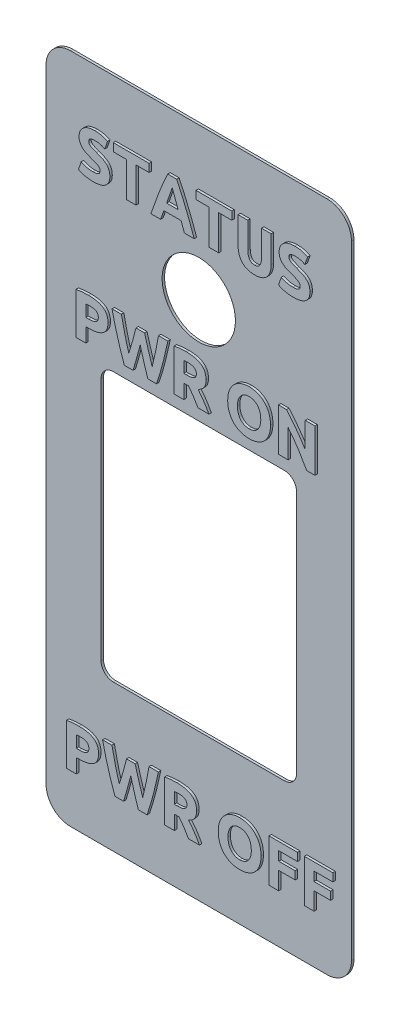
from build123d import *

# Parameters (mm, degrees)
SKETCH1_W       = 25
SKETCH1_H       = 55
BODY_DEPTH      = 0.2
SKETCH3_R       = 3
SKETCH3_W       = 16
SKETCH3_H       = 22
CUTS_DEPTH      = 61.415560909
TEXT_2_DEPTH    = 0.2
INSIDEFILLET_R  = 1
OUTSIDEFILLET_R = 2


with BuildPart() as part:
    # Sketch1 → Body (new body)
    with BuildSketch(Plane.XY):
        with Locations((12.5, 27.5)):
            Rectangle(SKETCH1_W, SKETCH1_H)
    extrude(amount=BODY_DEPTH)

    # Sketch3 → Cuts (cut, through all)
    with BuildSketch(Plane.XY.offset(0.2)):
        with Locations((12.5, 42.6)):
            Circle(SKETCH3_R)
        with Locations((12.5, 23)):
            Rectangle(SKETCH3_W, SKETCH3_H)
    extrude(amount=-CUTS_DEPTH, mode=Mode.SUBTRACT)

    # Sketch2 → Text 2 (add)
    # profile 1 of 17: a face of its own
    with BuildSketch(Plane.XY.offset(0.2)):
        with BuildLine():
            add(Edge.make_bspline(
                [(3.682833691, 38.602720073), (3.744833298, 38.601860351), (3.865315496, 38.600189677), (4.040362327, 38.587885794), (4.204294793, 38.567072242), (4.356989281, 38.537163665), (4.49902064, 38.499623484), (4.629993523, 38.453277109), (4.749471198, 38.397541235), (4.858263716, 38.334249733), (4.9560482, 38.261415658), (5.039492809, 38.175692799), (5.111040709, 38.080321914), (5.16914803, 37.973672985), (5.21439384, 37.856255197), (5.246058652, 37.72788918), (5.265156466, 37.58902283), (5.267539299, 37.492991801), (5.268771191, 37.443345073)],
                knots=[0, 0, 0, 0, 1.325600547, 2.576004481, 3.749846809, 4.856721366, 5.900528485, 6.888463448, 7.823128244, 8.715332888, 9.57596532, 10.421208284, 11.264163453, 12.11775309, 13.009518683, 13.947299133, 14.938781744, 16, 16, 16, 16], degree=3))
            add(Edge.make_bspline(
                [(5.268771191, 37.443345073), (5.267526356, 37.393216843), (5.265117796, 37.296226551), (5.246212895, 37.15609267), (5.21415023, 37.026994674), (5.169919766, 36.907946487), (5.110974851, 36.800482128), (5.040618235, 36.702785178), (4.956528342, 36.616607426), (4.859070175, 36.542304341), (4.750618271, 36.477212922), (4.630715521, 36.422139238), (4.500570901, 36.374548789), (4.358967514, 36.336370609), (4.206806124, 36.30557585), (4.043236711, 36.285235008), (3.869244278, 36.27165758), (3.7494587, 36.270157281), (3.687937858, 36.26938674)],
                knots=[0, 0, 0, 0, 1.06896955, 2.068289021, 3.008794142, 3.901354881, 4.768981424, 5.615138787, 6.462010509, 7.326829116, 8.222140804, 9.154509332, 10.136903291, 11.174500176, 12.279665072, 13.445482396, 14.688021727, 16, 16, 16, 16], degree=3))
            Line((3.687937858, 36.26938674), (3.448771191, 36.26938674))
            Line((3.448771191, 36.26938674), (3.448771191, 35.102720073))
            Line((3.448771191, 35.102720073), (2.655437858, 35.102720073))
            Line((2.655437858, 35.102720073), (2.655437858, 38.513032573))
            add(Edge.make_bspline(
                [(2.655437858, 38.513032573), (2.741794146, 38.528347669), (2.9186061, 38.559704875), (3.142985106, 38.579815683), (3.322578067, 38.591065104), (3.450415875, 38.597999209), (3.569549082, 38.601581971), (3.646130456, 38.602351338), (3.682833691, 38.602720073)],
                knots=[0, 0, 0, 0, 1.528131192, 3.128803549, 3.922685559, 4.665078126, 5.360210614, 6, 6, 6, 6], degree=3))
        make_face()
        with BuildLine():
            add(Edge.make_bspline(
                [(3.749187858, 37.902720073), (3.72196, 37.902417082), (3.667724333, 37.901813549), (3.588750763, 37.897755786), (3.515794621, 37.893859046), (3.469909846, 37.88994151), (3.448771191, 37.88813674)],
                knots=[0, 0, 0, 0, 1.086002376, 2.163227954, 3.153817568, 4, 4, 4, 4], degree=3))
            Line((3.448771191, 37.88813674), (3.448771191, 36.922720073))
            Line((3.448771191, 36.922720073), (3.685750358, 36.922720073))
            add(Edge.make_bspline(
                [(3.685750358, 36.922720073), (3.717356569, 36.922907462), (3.778669264, 36.923270978), (3.867676036, 36.928703403), (3.950941791, 36.936336142), (4.028158269, 36.947825204), (4.099002842, 36.963093129), (4.163726144, 36.98151819), (4.222839463, 37.002078005), (4.2759093, 37.02711582), (4.323749928, 37.055918031), (4.363905855, 37.092453178), (4.39881287, 37.13370689), (4.427473662, 37.180860805), (4.449446163, 37.23400335), (4.464241202, 37.292735274), (4.474212126, 37.356965219), (4.475017441, 37.401740743), (4.475437858, 37.425115906)],
                knots=[0, 0, 0, 0, 1.412938487, 2.740950628, 3.985596411, 5.150597474, 6.229163232, 7.223343861, 8.158325437, 9.023638265, 9.843826439, 10.644339473, 11.438854961, 12.253335525, 13.100998308, 13.999850554, 14.955817499, 16, 16, 16, 16], degree=3))
            add(Edge.make_bspline(
                [(4.475437858, 37.425115906), (4.474997196, 37.447516075), (4.474154513, 37.490352164), (4.464517841, 37.551582038), (4.448773394, 37.606943441), (4.425663576, 37.656189139), (4.397699859, 37.700706296), (4.364009455, 37.740483235), (4.324016358, 37.774756213), (4.279242384, 37.804917215), (4.229071087, 37.830191), (4.174210158, 37.852621293), (4.113516935, 37.868599892), (4.024322611, 37.886539031), (3.902237464, 37.900358256), (3.801725276, 37.901909331), (3.749187858, 37.902720073)],
                knots=[0, 0, 0, 0, 0.946025014, 1.80909402, 2.612046338, 3.370454406, 4.10006685, 4.82881088, 5.564258299, 6.319319203, 7.104998853, 7.934839974, 8.819646074, 9.752470745, 11.779829224, 14, 14, 14, 14], degree=3))
        make_face(mode=Mode.SUBTRACT)
    # profile 2 of 17: a face of its own
    with BuildSketch(Plane.XY.offset(0.2)):
        with BuildLine():
            add(Edge.make_bspline(
                [(8.263458691, 38.22938674), (8.27398773, 38.193679916), (8.295593306, 38.12040956), (8.327539849, 38.006480488), (8.361971273, 37.886349238), (8.408540544, 37.715046301), (8.471901016, 37.493347487), (8.551485059, 37.22131806), (8.635534663, 36.945067454), (8.718474578, 36.670062424), (8.800941759, 36.405063943), (8.857953857, 36.233815847), (8.885437858, 36.15126174)],
                knots=[0, 0, 0, 0, 0.514787516, 1.056343332, 1.636219765, 2.242897498, 3.511144836, 4.824667536, 6.16231266, 7.504148621, 8.796817093, 10, 10, 10, 10], degree=3))
            add(Edge.make_bspline(
                [(8.885437858, 36.15126174), (8.909078409, 36.240871068), (8.958238803, 36.427213162), (9.028114844, 36.71701379), (9.097194229, 37.023193096), (9.161674683, 37.340265857), (9.224741829, 37.66142111), (9.285366174, 37.981404857), (9.344504058, 38.294844194), (9.381880328, 38.501343175), (9.400229524, 38.602720073)],
                knots=[0, 0, 0, 0, 0.887641445, 1.845845402, 2.855134325, 3.893837689, 4.944857709, 5.989980011, 7.013217449, 8, 8, 8, 8], degree=3))
            Line((9.400229524, 38.602720073), (10.168771191, 38.602720073))
            add(Edge.make_bspline(
                [(10.168771191, 38.602720073), (10.137816528, 38.455584591), (10.075614983, 38.159924637), (9.974575743, 37.715913457), (9.867562594, 37.268552571), (9.753500014, 36.820640774), (9.635025134, 36.376225623), (9.510259025, 35.941107958), (9.381034403, 35.517193019), (9.28898191, 35.23986741), (9.243458691, 35.102720073)],
                knots=[0, 0, 0, 0, 0.996171026, 2.00174612, 3.016885972, 4.043703408, 5.064018451, 6.064065967, 7.042612042, 8, 8, 8, 8], degree=3))
            Line((9.243458691, 35.102720073), (8.529604524, 35.102720073))
            add(Edge.make_bspline(
                [(8.529604524, 35.102720073), (8.502160414, 35.184557146), (8.446732162, 35.349841638), (8.366796748, 35.601831937), (8.287293187, 35.859401717), (8.183346694, 36.211247215), (8.057002725, 36.655921737), (7.955968613, 37.012643937), (7.905437858, 37.191053406)],
                knots=[0, 0, 0, 0, 0.712730157, 1.439485038, 2.182876407, 2.938555447, 4.468862613, 6, 6, 6, 6], degree=3))
            add(Edge.make_bspline(
                [(7.905437858, 37.191053406), (7.857256867, 37.012665737), (7.760956071, 36.656116936), (7.641751331, 36.21144478), (7.5446834, 35.859443278), (7.470400815, 35.60176189), (7.394851271, 35.349767257), (7.341811135, 35.184547981), (7.315542024, 35.102720073)],
                knots=[0, 0, 0, 0, 1.532520251, 3.063094316, 3.818218999, 4.560860571, 5.287239532, 6, 6, 6, 6], degree=3))
            Line((7.315542024, 35.102720073), (6.606792024, 35.102720073))
            add(Edge.make_bspline(
                [(6.606792024, 35.102720073), (6.557051324, 35.239821957), (6.456532948, 35.516883977), (6.316081582, 35.941131046), (6.178551467, 36.375975059), (6.048298415, 36.820344457), (5.92462923, 37.268555242), (5.806799086, 37.715647003), (5.697502159, 38.159903293), (5.629350336, 38.455587196), (5.595437858, 38.602720073)],
                knots=[0, 0, 0, 0, 0.960075776, 1.940166882, 2.941648391, 3.962362445, 4.988356488, 6.002459984, 7.006020254, 8, 8, 8, 8], degree=3))
            Line((5.595437858, 38.602720073), (6.364708691, 38.602720073))
            add(Edge.make_bspline(
                [(6.364708691, 38.602720073), (6.385315293, 38.501303363), (6.427329311, 38.294528681), (6.49685787, 37.98117778), (6.57017173, 37.661346749), (6.645833034, 37.340037165), (6.725280017, 37.023490117), (6.804134285, 36.716730531), (6.885484799, 36.426745536), (6.943946907, 36.240813713), (6.972104524, 36.15126174)],
                knots=[0, 0, 0, 0, 0.983000772, 2.004202968, 3.048713323, 4.099816473, 5.139641892, 6.148714866, 7.108349323, 8, 8, 8, 8], degree=3))
            add(Edge.make_bspline(
                [(6.972104524, 36.15126174), (7.00101047, 36.236179407), (7.060317004, 36.410405589), (7.141758539, 36.679091532), (7.221791373, 36.954922635), (7.29911929, 37.231410353), (7.373954278, 37.502293898), (7.429722317, 37.723359967), (7.4734508, 37.892407576), (7.502702705, 38.011307865), (7.53234273, 38.122623678), (7.550866778, 38.194617669), (7.559812858, 38.22938674)],
                knots=[0, 0, 0, 0, 1.24565066, 2.555710326, 3.898445127, 5.234225297, 6.542731663, 7.801036238, 8.400300463, 8.967628795, 9.501422454, 10, 10, 10, 10], degree=3))
            Line((7.559812858, 38.22938674), (8.263458691, 38.22938674))
        make_face()
    # profile 3 of 17: a face of its own
    with BuildSketch(Plane.XY.offset(0.2)):
        with BuildLine():
            add(Edge.make_bspline(
                [(11.692729524, 38.602720073), (11.755466687, 38.602001515), (11.87745783, 38.600604293), (12.054909156, 38.586327436), (12.221037526, 38.564252187), (12.375889475, 38.533116456), (12.519377363, 38.492463842), (12.651658545, 38.442265235), (12.772690389, 38.38323744), (12.882224602, 38.315229896), (12.980223741, 38.237992065), (13.064792054, 38.149425744), (13.136870948, 38.051391177), (13.194993259, 37.942448823), (13.239886759, 37.823729904), (13.272931437, 37.695444567), (13.291757403, 37.556924222), (13.294183445, 37.461388673), (13.295437858, 37.411990906)],
                knots=[0, 0, 0, 0, 1.323195531, 2.572926946, 3.752702485, 4.856794983, 5.901955216, 6.895139641, 7.837583089, 8.738146909, 9.610161184, 10.462354364, 11.313544374, 12.169200986, 13.058573228, 13.985037133, 14.958140029, 16, 16, 16, 16], degree=3))
            add(Edge.make_bspline(
                [(13.295437858, 37.411990906), (13.294727259, 37.381117703), (13.293332088, 37.320502062), (13.286845911, 37.231652779), (13.272166582, 37.147595777), (13.254726733, 37.067584868), (13.22997302, 36.992618588), (13.202456062, 36.921103936), (13.166375405, 36.855559646), (13.127451102, 36.793111561), (13.082270516, 36.735178101), (13.032571589, 36.680573267), (12.97869888, 36.628666986), (12.919845368, 36.580314312), (12.856543714, 36.535169734), (12.788198035, 36.493511331), (12.715365711, 36.454830992), (12.664360584, 36.431945938), (12.638458691, 36.42032424)],
                knots=[0, 0, 0, 0, 1.16408502, 2.285534098, 3.35338712, 4.377917611, 5.368798573, 6.326600612, 7.261071654, 8.18365597, 9.098061712, 10.025545703, 10.965077782, 11.915225375, 12.893961424, 13.893277004, 14.930144568, 16, 16, 16, 16], degree=3))
            add(Edge.make_bspline(
                [(12.638458691, 36.42032424), (12.676069614, 36.377411716), (12.754872949, 36.287500337), (12.868749549, 36.140481132), (12.986435721, 35.983073823), (13.10314594, 35.816501896), (13.217588146, 35.643387194), (13.32742647, 35.464464447), (13.431579763, 35.283950683), (13.496746792, 35.162435231), (13.528771191, 35.102720073)],
                knots=[0, 0, 0, 0, 0.859087965, 1.799982338, 2.799188227, 3.818660709, 4.862217286, 5.923719699, 6.97967376, 8, 8, 8, 8], degree=3))
            Line((13.528771191, 35.102720073), (12.637000358, 35.102720073))
            add(Edge.make_bspline(
                [(12.637000358, 35.102720073), (12.605442551, 35.155487417), (12.541984558, 35.261594593), (12.445777404, 35.420814811), (12.349980155, 35.580087421), (12.248765288, 35.732998982), (12.148934514, 35.880703396), (12.049393172, 36.02028364), (11.95133983, 36.150606084), (11.882258663, 36.230606232), (11.848771191, 36.26938674)],
                knots=[0, 0, 0, 0, 1.046576105, 2.104506798, 3.166732658, 4.20983562, 5.225400073, 6.201253054, 7.128047626, 8, 8, 8, 8], degree=3))
            Line((11.848771191, 36.26938674), (11.475437858, 36.26938674))
            Line((11.475437858, 36.26938674), (11.475437858, 35.102720073))
            Line((11.475437858, 35.102720073), (10.682104524, 35.102720073))
            Line((10.682104524, 35.102720073), (10.682104524, 38.512303406))
            add(Edge.make_bspline(
                [(10.682104524, 38.512303406), (10.767966953, 38.527887908), (10.941840858, 38.559446975), (11.161869325, 38.579755926), (11.336843438, 38.591139382), (11.461769728, 38.597985029), (11.579686968, 38.601617793), (11.655783039, 38.602359807), (11.692729524, 38.602720073)],
                knots=[0, 0, 0, 0, 1.545275474, 3.129227617, 3.910286877, 4.651896258, 5.345462976, 6, 6, 6, 6], degree=3))
        make_face()
        with BuildLine():
            add(Edge.make_bspline(
                [(11.751792024, 37.902720073), (11.725294231, 37.902420197), (11.674945762, 37.901850403), (11.603213794, 37.89816101), (11.537655059, 37.892568478), (11.495855027, 37.889101173), (11.475437858, 37.887407573)],
                knots=[0, 0, 0, 0, 1.148423025, 2.182119157, 3.112058531, 4, 4, 4, 4], degree=3))
            Line((11.475437858, 37.887407573), (11.475437858, 36.96938674))
            Line((11.475437858, 36.96938674), (11.692729524, 36.96938674))
            add(Edge.make_bspline(
                [(11.692729524, 36.96938674), (11.727735834, 36.969592892), (11.79511599, 36.969989695), (11.892193366, 36.97504969), (11.981467455, 36.983790676), (12.063198054, 36.995486406), (12.137567952, 37.009153365), (12.20367789, 37.028563928), (12.26227768, 37.050266275), (12.314123902, 37.07474064), (12.358924522, 37.104373414), (12.396959788, 37.139233414), (12.430524262, 37.177822171), (12.456634141, 37.222295794), (12.477229818, 37.27083514), (12.491765018, 37.324037663), (12.500595545, 37.382042099), (12.501589187, 37.422409255), (12.502104524, 37.443345073)],
                knots=[0, 0, 0, 0, 1.569710554, 3.021379303, 4.357561853, 5.590724005, 6.723665517, 7.74475431, 8.676026497, 9.524245769, 10.310235503, 11.074227105, 11.832051402, 12.594720073, 13.376162096, 14.190656129, 15.061611001, 16, 16, 16, 16], degree=3))
            add(Edge.make_bspline(
                [(12.502104524, 37.443345073), (12.501541231, 37.463299074), (12.500443244, 37.502194022), (12.49205394, 37.558462477), (12.476187511, 37.609854263), (12.45635029, 37.657342491), (12.4283852, 37.699310695), (12.395789865, 37.737594702), (12.356374507, 37.770642779), (12.311314352, 37.799127064), (12.260844031, 37.823770326), (12.204635632, 37.844953603), (12.142980797, 37.863047129), (12.075401238, 37.877346865), (12.002669962, 37.889140172), (11.924002858, 37.896771786), (11.839853592, 37.902155944), (11.781697333, 37.902528497), (11.751792024, 37.902720073)],
                knots=[0, 0, 0, 0, 0.958315074, 1.867976987, 2.721056791, 3.536489789, 4.329731121, 5.13244917, 5.94402984, 6.78916638, 7.687068829, 8.636599371, 9.670820008, 10.769808753, 11.951944573, 13.207526485, 14.564044812, 16, 16, 16, 16], degree=3))
        make_face(mode=Mode.SUBTRACT)
    # profile 4 of 17: a face of its own
    with BuildSketch(Plane.XY.offset(0.2)):
        with BuildLine():
            add(Edge.make_bspline(
                [(18.568771191, 36.850532573), (18.56837926, 36.813333588), (18.567605022, 36.73984909), (18.560622666, 36.631394273), (18.550801472, 36.526250146), (18.536109138, 36.424548351), (18.517283071, 36.326210246), (18.494014049, 36.231259471), (18.466180638, 36.140089274), (18.424762134, 36.024447872), (18.36468326, 35.887831561), (18.278212883, 35.736409488), (18.18031286, 35.597936513), (18.069067471, 35.474254311), (17.9457334, 35.365443919), (17.812207887, 35.269278298), (17.666438816, 35.189438219), (17.510723248, 35.123704631), (17.346592875, 35.073305928), (17.17623742, 35.035726302), (16.999466592, 35.013474631), (16.879597795, 35.010762827), (16.818771191, 35.00938674)],
                knots=[0, 0, 0, 0, 0.77788334, 1.536664701, 2.272100781, 2.985945968, 3.684792735, 4.365338032, 5.02945352, 5.67742052, 6.933667013, 8.144852034, 9.318406293, 10.47382072, 11.615285519, 12.752202562, 13.908019464, 15.083432763, 16.281231506, 17.493663913, 18.728176821, 20, 20, 20, 20], degree=3))
            add(Edge.make_bspline(
                [(16.818771191, 35.00938674), (16.759646844, 35.010790938), (16.642447019, 35.013574424), (16.469296268, 35.035699056), (16.301422755, 35.073504696), (16.139024981, 35.123865042), (15.984124024, 35.189310447), (15.838783521, 35.270125911), (15.703510716, 35.365065733), (15.578728515, 35.474468985), (15.465320203, 35.597841435), (15.365068078, 35.736111432), (15.277421124, 35.887966686), (15.215269826, 36.024301699), (15.172614431, 36.139938777), (15.145276249, 36.231394809), (15.120663176, 36.326073861), (15.10248556, 36.42463984), (15.086453825, 36.526169761), (15.077000803, 36.631406858), (15.069916221, 36.739845809), (15.069156018, 36.813332486), (15.068771191, 36.850532573)],
                knots=[0, 0, 0, 0, 1.238756852, 2.455538072, 3.65051486, 4.841000036, 6.014087787, 7.167774736, 8.319447317, 9.470849546, 10.638861897, 11.82371135, 13.04240997, 14.307443833, 14.958450189, 15.623901685, 16.307051378, 17.007304022, 17.723328409, 18.460243974, 19.220551784, 20, 20, 20, 20], degree=3))
            add(Edge.make_bspline(
                [(15.068771191, 36.850532573), (15.069179001, 36.887730485), (15.069984607, 36.961212865), (15.076724961, 37.069466071), (15.087373322, 37.174649992), (15.103746669, 37.27598505), (15.122952622, 37.374511396), (15.148231441, 37.468938668), (15.176077002, 37.560581288), (15.221151748, 37.676124552), (15.284343718, 37.813142862), (15.374906942, 37.964892253), (15.476184864, 38.104043402), (15.591336141, 38.22812789), (15.716929032, 38.338210634), (15.851726548, 38.434975231), (15.997310569, 38.514992583), (16.150803776, 38.581514878), (16.311623189, 38.631912309), (16.47682938, 38.669593704), (16.646564168, 38.69185675), (16.761103111, 38.694648045), (16.818771191, 38.696053406)],
                knots=[0, 0, 0, 0, 0.780684547, 1.542198328, 2.27571998, 2.998699156, 3.69604342, 4.381549727, 5.049558386, 5.705179783, 6.983263932, 8.211642688, 9.408514903, 10.589043099, 11.756670172, 12.908950481, 14.064467365, 15.236732553, 16.414512855, 17.596451138, 18.789860936, 20, 20, 20, 20], degree=3))
            add(Edge.make_bspline(
                [(16.818771191, 38.696053406), (16.878141827, 38.694677237), (16.99535007, 38.691960431), (17.168700907, 38.669563738), (17.336405643, 38.632132809), (17.498899065, 38.581606011), (17.653228812, 38.51521667), (17.798966254, 38.434673609), (17.934286778, 38.338892814), (18.058584899, 38.228006149), (18.17230113, 38.103985631), (18.272234808, 37.965029674), (18.360364332, 37.812975461), (18.422141165, 37.676215491), (18.464935515, 37.560401815), (18.492277079, 37.468942259), (18.516765586, 37.374483731), (18.535232378, 37.275969222), (18.550948908, 37.174633321), (18.560603308, 37.069422333), (18.567614147, 36.961217899), (18.568382327, 36.887732177), (18.568771191, 36.850532573)],
                knots=[0, 0, 0, 0, 1.242646412, 2.453206041, 3.651997724, 4.836480769, 6.010434965, 7.163009263, 8.316504282, 9.473529405, 10.644170459, 11.831993434, 13.049516702, 14.317962612, 14.968341118, 15.633150832, 16.315641674, 17.010222923, 17.730588599, 18.461728963, 19.221303508, 20, 20, 20, 20], degree=3))
        make_face()
        with BuildLine():
            add(Edge.make_bspline(
                [(15.862104524, 36.850532573), (15.863036457, 36.808216318), (15.864855736, 36.725608306), (15.876370739, 36.604651983), (15.896588149, 36.490262265), (15.925309652, 36.382609603), (15.960484613, 36.281459683), (16.004853056, 36.188294863), (16.054099154, 36.101116708), (16.111995755, 36.022233571), (16.176922771, 35.951183419), (16.249063503, 35.888833109), (16.327381059, 35.834525535), (16.412606274, 35.788889258), (16.504889414, 35.753090242), (16.60378852, 35.727846673), (16.709132784, 35.712062079), (16.781525808, 35.710295582), (16.818771191, 35.70938674)],
                knots=[0, 0, 0, 0, 1.208741036, 2.359653348, 3.466850005, 4.522728116, 5.539419154, 6.520866897, 7.466395157, 8.395389636, 9.309345558, 10.209993634, 11.113206902, 12.026371407, 12.964966817, 13.933212954, 14.93666169, 16, 16, 16, 16], degree=3))
            add(Edge.make_bspline(
                [(16.818771191, 35.70938674), (16.855285592, 35.710319227), (16.926704929, 35.7121431), (17.03085457, 35.727812781), (17.129426996, 35.75331972), (17.222140301, 35.789064042), (17.308575383, 35.834281762), (17.387650091, 35.888907791), (17.460600962, 35.950703401), (17.524795623, 36.022497753), (17.582635359, 36.101285785), (17.632828521, 36.18807804), (17.677003656, 36.281489744), (17.712248051, 36.382601091), (17.740949844, 36.490264703), (17.761172887, 36.604651291), (17.772686311, 36.725608492), (17.774505812, 36.808216381), (17.775437858, 36.850532573)],
                knots=[0, 0, 0, 0, 1.042915088, 2.039861045, 3.001741122, 3.947157272, 4.87293042, 5.782195926, 6.688432575, 7.598042836, 8.527378213, 9.476740244, 10.458548133, 11.475612251, 12.53187782, 13.639480767, 14.790815412, 16, 16, 16, 16], degree=3))
            add(Edge.make_bspline(
                [(17.775437858, 36.850532573), (17.774503148, 36.892848165), (17.772678449, 36.975454882), (17.761202121, 37.096420447), (17.740764268, 37.21124052), (17.712235439, 37.319895187), (17.67716583, 37.422295446), (17.632789607, 37.516595482), (17.582837436, 37.604022565), (17.524818952, 37.682985437), (17.460330413, 37.754651445), (17.388138874, 37.817415684), (17.308295403, 37.870999893), (17.222184156, 37.916437536), (17.129414931, 37.952103526), (17.030857938, 37.977632084), (16.926704028, 37.993295784), (16.855285287, 37.995120492), (16.818771191, 37.996053406)],
                knots=[0, 0, 0, 0, 1.206209852, 2.354712077, 3.45959019, 4.526656052, 5.554286079, 6.539956122, 7.492969712, 8.420018815, 9.327391327, 10.235926867, 11.139057564, 12.0625532, 13.005643515, 13.965157254, 14.959650606, 16, 16, 16, 16], degree=3))
            add(Edge.make_bspline(
                [(16.818771191, 37.996053406), (16.781517025, 37.995213582), (16.709070768, 37.993580418), (16.603751157, 37.976821544), (16.504846273, 37.950901382), (16.412566772, 37.914351424), (16.32734705, 37.867983967), (16.249046648, 37.812936494), (16.176872821, 37.749880393), (16.112235488, 37.678139238), (16.053853427, 37.599127424), (16.004908846, 37.511262927), (15.960305614, 37.417228214), (15.925449848, 37.314990737), (15.896748578, 37.206881467), (15.876405463, 37.093013104), (15.864875003, 36.973514569), (15.86304138, 36.892119764), (15.862104524, 36.850532573)],
                knots=[0, 0, 0, 0, 1.062479107, 2.066148417, 3.035376387, 3.975749923, 4.891466974, 5.797914246, 6.70239508, 7.620735968, 8.548979796, 9.499760825, 10.486701141, 11.515655516, 12.577387029, 13.676860425, 14.813034232, 16, 16, 16, 16], degree=3))
        make_face(mode=Mode.SUBTRACT)
    # profile 5 of 17: a face of its own
    with BuildSketch(Plane.XY.offset(0.2)):
        with BuildLine():
            add(Edge.make_bspline(
                [(21.536479524, 35.102720073), (21.481254373, 35.202861574), (21.370426157, 35.40382986), (21.19585908, 35.701595579), (21.015054413, 35.997724328), (20.828054806, 36.291186868), (20.635248076, 36.579963037), (20.434953515, 36.860731076), (20.22981843, 37.134196066), (20.086736641, 37.310355236), (20.015437858, 37.39813674)],
                knots=[0, 0, 0, 0, 0.995223852, 1.997258185, 3.003610145, 4.014659662, 5.02550337, 6.025076504, 7.01588005, 8, 8, 8, 8], degree=3))
            Line((20.015437858, 37.39813674), (20.015437858, 35.102720073))
            Line((20.015437858, 35.102720073), (19.222104524, 35.102720073))
            Line((19.222104524, 35.102720073), (19.222104524, 38.602720073))
            Line((19.222104524, 38.602720073), (19.879812858, 38.602720073))
            add(Edge.make_bspline(
                [(19.879812858, 38.602720073), (19.907394284, 38.573418086), (19.964942459, 38.512279991), (20.052272726, 38.414797169), (20.143339084, 38.307288317), (20.272139003, 38.149599459), (20.43814266, 37.938768808), (20.63827684, 37.672004711), (20.840520175, 37.392523379), (21.03866035, 37.104442729), (21.231995829, 36.818396145), (21.355239596, 36.627377201), (21.415437858, 36.53407424)],
                knots=[0, 0, 0, 0, 0.467999514, 0.976472983, 1.52193025, 2.106471024, 3.344381234, 4.642436353, 5.984808165, 7.356235799, 8.708656729, 10, 10, 10, 10], degree=3))
            Line((21.415437858, 36.53407424), (21.415437858, 38.602720073))
            Line((21.415437858, 38.602720073), (22.208771191, 38.602720073))
            Line((22.208771191, 38.602720073), (22.208771191, 35.102720073))
            Line((22.208771191, 35.102720073), (21.536479524, 35.102720073))
        make_face()
    # profile 6 of 17: a face of its own
    with BuildSketch(Plane.XY.offset(0.2)):
        with BuildLine():
            add(Edge.make_bspline(
                [(2.908854744, 7.665486575), (2.970854352, 7.664626854), (3.091336549, 7.662956179), (3.26638338, 7.650652296), (3.430315847, 7.629838744), (3.583010334, 7.599930167), (3.725041693, 7.562389986), (3.856014576, 7.516043611), (3.975492251, 7.460307738), (4.084284769, 7.397016235), (4.182069253, 7.32418216), (4.265513863, 7.238459301), (4.337061762, 7.143088416), (4.395169083, 7.036439487), (4.440414894, 6.919021699), (4.472079705, 6.790655683), (4.491177519, 6.651789332), (4.493560352, 6.555758303), (4.494792244, 6.506111575)],
                knots=[0, 0, 0, 0, 1.325600547, 2.576004481, 3.749846809, 4.856721366, 5.900528485, 6.888463448, 7.823128244, 8.715332888, 9.57596532, 10.421208284, 11.264163453, 12.11775309, 13.009518683, 13.947299133, 14.938781744, 16, 16, 16, 16], degree=3))
            add(Edge.make_bspline(
                [(4.494792244, 6.506111575), (4.49354741, 6.455983345), (4.491138849, 6.358993053), (4.472233948, 6.218859172), (4.440171283, 6.089761176), (4.395940819, 5.97071299), (4.336995904, 5.86324863), (4.266639288, 5.76555168), (4.182549396, 5.679373928), (4.085091228, 5.605070843), (3.976639324, 5.539979424), (3.856736575, 5.48490574), (3.726591954, 5.437315292), (3.584988567, 5.399137111), (3.432827177, 5.368342352), (3.269257764, 5.34800151), (3.095265331, 5.334424082), (2.975479753, 5.332923783), (2.913958911, 5.332153242)],
                knots=[0, 0, 0, 0, 1.06896955, 2.068289021, 3.008794142, 3.901354881, 4.768981424, 5.615138787, 6.462010509, 7.326829116, 8.222140804, 9.154509332, 10.136903291, 11.174500176, 12.279665072, 13.445482396, 14.688021727, 16, 16, 16, 16], degree=3))
            Line((2.913958911, 5.332153242), (2.674792244, 5.332153242))
            Line((2.674792244, 5.332153242), (2.674792244, 4.165486575))
            Line((2.674792244, 4.165486575), (1.881458911, 4.165486575))
            Line((1.881458911, 4.165486575), (1.881458911, 7.575799075))
            add(Edge.make_bspline(
                [(1.881458911, 7.575799075), (1.967815199, 7.591114171), (2.144627153, 7.622471377), (2.369006159, 7.642582185), (2.54859912, 7.653831606), (2.676436928, 7.660765711), (2.795570135, 7.664348473), (2.87215151, 7.66511784), (2.908854744, 7.665486575)],
                knots=[0, 0, 0, 0, 1.528131192, 3.128803549, 3.922685559, 4.665078126, 5.360210614, 6, 6, 6, 6], degree=3))
        make_face()
        with BuildLine():
            add(Edge.make_bspline(
                [(2.975208911, 6.965486575), (2.947981053, 6.965183584), (2.893745386, 6.964580051), (2.814771816, 6.960522288), (2.741815674, 6.956625548), (2.695930899, 6.952708012), (2.674792244, 6.950903242)],
                knots=[0, 0, 0, 0, 1.086002376, 2.163227954, 3.153817568, 4, 4, 4, 4], degree=3))
            Line((2.674792244, 6.950903242), (2.674792244, 5.985486575))
            Line((2.674792244, 5.985486575), (2.911771411, 5.985486575))
            add(Edge.make_bspline(
                [(2.911771411, 5.985486575), (2.943377622, 5.985673964), (3.004690317, 5.98603748), (3.093697089, 5.991469905), (3.176962845, 5.999102644), (3.254179323, 6.010591707), (3.325023895, 6.025859631), (3.389747197, 6.044284692), (3.448860516, 6.064844507), (3.501930354, 6.089882322), (3.549770981, 6.118684533), (3.589926908, 6.15521968), (3.624833923, 6.196473392), (3.653494715, 6.243627307), (3.675467216, 6.296769852), (3.690262256, 6.355501776), (3.700233179, 6.419731721), (3.701038494, 6.464507245), (3.701458911, 6.487882409)],
                knots=[0, 0, 0, 0, 1.412938487, 2.740950628, 3.985596411, 5.150597474, 6.229163232, 7.223343861, 8.158325437, 9.023638265, 9.843826439, 10.644339473, 11.438854961, 12.253335525, 13.100998308, 13.999850554, 14.955817499, 16, 16, 16, 16], degree=3))
            add(Edge.make_bspline(
                [(3.701458911, 6.487882409), (3.701018249, 6.510282578), (3.700175567, 6.553118666), (3.690538894, 6.614348541), (3.674794447, 6.669709943), (3.65168463, 6.718955641), (3.623720912, 6.763472799), (3.590030509, 6.803249737), (3.550037411, 6.837522715), (3.505263437, 6.867683717), (3.455092141, 6.892957502), (3.400231211, 6.915387795), (3.339537989, 6.931366394), (3.250343664, 6.949305533), (3.128258518, 6.963124758), (3.027746329, 6.964675833), (2.975208911, 6.965486575)],
                knots=[0, 0, 0, 0, 0.946025014, 1.80909402, 2.612046338, 3.370454406, 4.10006685, 4.82881088, 5.564258299, 6.319319203, 7.104998853, 7.934839974, 8.819646074, 9.752470745, 11.779829224, 14, 14, 14, 14], degree=3))
        make_face(mode=Mode.SUBTRACT)
    # profile 7 of 17: a face of its own
    with BuildSketch(Plane.XY.offset(0.2)):
        with BuildLine():
            add(Edge.make_bspline(
                [(7.489479744, 7.292153242), (7.500008784, 7.256446418), (7.52161436, 7.183176062), (7.553560902, 7.06924699), (7.587992326, 6.949115741), (7.634561597, 6.777812803), (7.697922069, 6.556113989), (7.777506112, 6.284084562), (7.861555716, 6.007833956), (7.944495632, 5.732828926), (8.026962812, 5.467830445), (8.08397491, 5.296582349), (8.111458911, 5.214028242)],
                knots=[0, 0, 0, 0, 0.514787516, 1.056343332, 1.636219765, 2.242897498, 3.511144836, 4.824667536, 6.16231266, 7.504148621, 8.796817093, 10, 10, 10, 10], degree=3))
            add(Edge.make_bspline(
                [(8.111458911, 5.214028242), (8.135099462, 5.30363757), (8.184259856, 5.489979664), (8.254135897, 5.779780292), (8.323215282, 6.085959599), (8.387695736, 6.403032359), (8.450762882, 6.724187612), (8.511387227, 7.044171359), (8.570525111, 7.357610697), (8.607901381, 7.564109677), (8.626250577, 7.665486575)],
                knots=[0, 0, 0, 0, 0.887641445, 1.845845402, 2.855134325, 3.893837689, 4.944857709, 5.989980011, 7.013217449, 8, 8, 8, 8], degree=3))
            Line((8.626250577, 7.665486575), (9.394792244, 7.665486575))
            add(Edge.make_bspline(
                [(9.394792244, 7.665486575), (9.363837581, 7.518351093), (9.301636036, 7.222691139), (9.200596797, 6.778679959), (9.093583647, 6.331319073), (8.979521067, 5.883407276), (8.861046187, 5.438992125), (8.736280078, 5.00387446), (8.607055456, 4.579959521), (8.515002963, 4.302633913), (8.469479744, 4.165486575)],
                knots=[0, 0, 0, 0, 0.996171026, 2.00174612, 3.016885972, 4.043703408, 5.064018451, 6.064065967, 7.042612042, 8, 8, 8, 8], degree=3))
            Line((8.469479744, 4.165486575), (7.755625577, 4.165486575))
            add(Edge.make_bspline(
                [(7.755625577, 4.165486575), (7.728181467, 4.247323648), (7.672753215, 4.41260814), (7.592817801, 4.664598439), (7.51331424, 4.92216822), (7.409367747, 5.274013717), (7.283023778, 5.718688239), (7.181989666, 6.075410439), (7.131458911, 6.253819909)],
                knots=[0, 0, 0, 0, 0.712730157, 1.439485038, 2.182876407, 2.938555447, 4.468862613, 6, 6, 6, 6], degree=3))
            add(Edge.make_bspline(
                [(7.131458911, 6.253819909), (7.08327792, 6.075432239), (6.986977125, 5.718883438), (6.867772384, 5.274211282), (6.770704453, 4.922209781), (6.696421868, 4.664528392), (6.620872324, 4.412533759), (6.567832188, 4.247314483), (6.541563077, 4.165486575)],
                knots=[0, 0, 0, 0, 1.532520251, 3.063094316, 3.818218999, 4.560860571, 5.287239532, 6, 6, 6, 6], degree=3))
            Line((6.541563077, 4.165486575), (5.832813077, 4.165486575))
            add(Edge.make_bspline(
                [(5.832813077, 4.165486575), (5.783072378, 4.302588459), (5.682554001, 4.579650479), (5.542102635, 5.003897548), (5.40457252, 5.438741562), (5.274319468, 5.883110959), (5.150650283, 6.331321744), (5.032820139, 6.778413505), (4.923523212, 7.222669795), (4.855371389, 7.518353698), (4.821458911, 7.665486575)],
                knots=[0, 0, 0, 0, 0.960075776, 1.940166882, 2.941648391, 3.962362445, 4.988356488, 6.002459984, 7.006020254, 8, 8, 8, 8], degree=3))
            Line((4.821458911, 7.665486575), (5.590729744, 7.665486575))
            add(Edge.make_bspline(
                [(5.590729744, 7.665486575), (5.611336346, 7.564069865), (5.653350364, 7.357295183), (5.722878923, 7.043944282), (5.796192783, 6.724113251), (5.871854087, 6.402803667), (5.95130107, 6.086256619), (6.030155338, 5.779497033), (6.111505852, 5.489512039), (6.16996796, 5.303580215), (6.198125577, 5.214028242)],
                knots=[0, 0, 0, 0, 0.983000772, 2.004202968, 3.048713323, 4.099816473, 5.139641892, 6.148714866, 7.108349323, 8, 8, 8, 8], degree=3))
            add(Edge.make_bspline(
                [(6.198125577, 5.214028242), (6.227031523, 5.298945909), (6.286338057, 5.473172091), (6.367779592, 5.741858034), (6.447812426, 6.017689137), (6.525140343, 6.294176855), (6.599975332, 6.5650604), (6.655743371, 6.786126469), (6.699471853, 6.955174079), (6.728723759, 7.074074367), (6.758363783, 7.18539018), (6.776887832, 7.257384171), (6.785833911, 7.292153242)],
                knots=[0, 0, 0, 0, 1.24565066, 2.555710326, 3.898445127, 5.234225297, 6.542731663, 7.801036238, 8.400300463, 8.967628795, 9.501422454, 10, 10, 10, 10], degree=3))
            Line((6.785833911, 7.292153242), (7.489479744, 7.292153242))
        make_face()
    # profile 8 of 17: a face of its own
    with BuildSketch(Plane.XY.offset(0.2)):
        with BuildLine():
            add(Edge.make_bspline(
                [(10.918750577, 7.665486575), (10.98148774, 7.664768017), (11.103478883, 7.663370795), (11.28093021, 7.649093938), (11.447058579, 7.627018689), (11.601910528, 7.595882958), (11.745398416, 7.555230344), (11.877679598, 7.505031737), (11.998711442, 7.446003942), (12.108245655, 7.377996398), (12.206244795, 7.300758567), (12.290813107, 7.212192246), (12.362892001, 7.114157679), (12.421014312, 7.005215325), (12.465907812, 6.886496406), (12.498952491, 6.75821107), (12.517778456, 6.619690724), (12.520204498, 6.524155175), (12.521458911, 6.474757409)],
                knots=[0, 0, 0, 0, 1.323195531, 2.572926946, 3.752702485, 4.856794983, 5.901955216, 6.895139641, 7.837583089, 8.738146909, 9.610161184, 10.462354364, 11.313544374, 12.169200986, 13.058573228, 13.985037133, 14.958140029, 16, 16, 16, 16], degree=3))
            add(Edge.make_bspline(
                [(12.521458911, 6.474757409), (12.520748312, 6.443884205), (12.519353141, 6.383268564), (12.512866964, 6.294419281), (12.498187636, 6.210362279), (12.480747786, 6.130351371), (12.455994073, 6.055385091), (12.428477115, 5.983870438), (12.392396459, 5.918326148), (12.353472156, 5.855878063), (12.308291569, 5.797944603), (12.258592642, 5.743339769), (12.204719933, 5.691433488), (12.145866422, 5.643080814), (12.082564767, 5.597936236), (12.014219088, 5.556277833), (11.941386765, 5.517597494), (11.890381637, 5.49471244), (11.864479744, 5.483090742)],
                knots=[0, 0, 0, 0, 1.16408502, 2.285534098, 3.35338712, 4.377917611, 5.368798573, 6.326600612, 7.261071654, 8.18365597, 9.098061712, 10.025545703, 10.965077782, 11.915225375, 12.893961424, 13.893277004, 14.930144568, 16, 16, 16, 16], degree=3))
            add(Edge.make_bspline(
                [(11.864479744, 5.483090742), (11.902090667, 5.440178218), (11.980894002, 5.350266839), (12.094770603, 5.203247634), (12.212456774, 5.045840325), (12.329166993, 4.879268398), (12.443609199, 4.706153696), (12.553447523, 4.527230949), (12.657600816, 4.346717185), (12.722767845, 4.225201733), (12.754792244, 4.165486575)],
                knots=[0, 0, 0, 0, 0.859087965, 1.799982338, 2.799188227, 3.818660709, 4.862217286, 5.923719699, 6.97967376, 8, 8, 8, 8], degree=3))
            Line((12.754792244, 4.165486575), (11.863021411, 4.165486575))
            add(Edge.make_bspline(
                [(11.863021411, 4.165486575), (11.831463604, 4.218253919), (11.768005611, 4.324361095), (11.671798457, 4.483581313), (11.576001208, 4.642853923), (11.474786341, 4.795765484), (11.374955567, 4.943469898), (11.275414225, 5.083050142), (11.177360883, 5.213372586), (11.108279716, 5.293372734), (11.074792244, 5.332153242)],
                knots=[0, 0, 0, 0, 1.046576105, 2.104506798, 3.166732658, 4.20983562, 5.225400073, 6.201253054, 7.128047626, 8, 8, 8, 8], degree=3))
            Line((11.074792244, 5.332153242), (10.701458911, 5.332153242))
            Line((10.701458911, 5.332153242), (10.701458911, 4.165486575))
            Line((10.701458911, 4.165486575), (9.908125577, 4.165486575))
            Line((9.908125577, 4.165486575), (9.908125577, 7.575069909))
            add(Edge.make_bspline(
                [(9.908125577, 7.575069909), (9.993988006, 7.59065441), (10.167861912, 7.622213477), (10.387890378, 7.642522428), (10.562864492, 7.653905884), (10.687790782, 7.660751531), (10.805708021, 7.664384295), (10.881804092, 7.665126309), (10.918750577, 7.665486575)],
                knots=[0, 0, 0, 0, 1.545275474, 3.129227617, 3.910286877, 4.651896258, 5.345462976, 6, 6, 6, 6], degree=3))
        make_face()
        with BuildLine():
            add(Edge.make_bspline(
                [(10.977813077, 6.965486575), (10.951315285, 6.965186699), (10.900966815, 6.964616905), (10.829234847, 6.960927513), (10.763676113, 6.95533498), (10.721876081, 6.951867676), (10.701458911, 6.950174075)],
                knots=[0, 0, 0, 0, 1.148423025, 2.182119157, 3.112058531, 4, 4, 4, 4], degree=3))
            Line((10.701458911, 6.950174075), (10.701458911, 6.032153242))
            Line((10.701458911, 6.032153242), (10.918750577, 6.032153242))
            add(Edge.make_bspline(
                [(10.918750577, 6.032153242), (10.953756888, 6.032359394), (11.021137043, 6.032756197), (11.118214419, 6.037816192), (11.207488508, 6.046557178), (11.289219107, 6.058252908), (11.363589005, 6.071919867), (11.429698943, 6.09133043), (11.488298733, 6.113032777), (11.540144955, 6.137507142), (11.584945575, 6.167139917), (11.622980841, 6.201999916), (11.656545316, 6.240588673), (11.682655195, 6.285062296), (11.703250871, 6.333601642), (11.717786071, 6.386804165), (11.726616598, 6.444808601), (11.72761024, 6.485175757), (11.728125577, 6.506111575)],
                knots=[0, 0, 0, 0, 1.569710554, 3.021379303, 4.357561853, 5.590724005, 6.723665517, 7.74475431, 8.676026497, 9.524245769, 10.310235503, 11.074227105, 11.832051402, 12.594720073, 13.376162096, 14.190656129, 15.061611001, 16, 16, 16, 16], degree=3))
            add(Edge.make_bspline(
                [(11.728125577, 6.506111575), (11.727562285, 6.526065576), (11.726464297, 6.564960524), (11.718074993, 6.621228979), (11.702208565, 6.672620765), (11.682371343, 6.720108993), (11.654406254, 6.762077198), (11.621810918, 6.800361205), (11.58239556, 6.833409281), (11.537335405, 6.861893566), (11.486865084, 6.886536828), (11.430656685, 6.907720105), (11.369001851, 6.925813631), (11.301422291, 6.940113367), (11.228691015, 6.951906674), (11.150023911, 6.959538288), (11.065874645, 6.964922446), (11.007718386, 6.965295), (10.977813077, 6.965486575)],
                knots=[0, 0, 0, 0, 0.958315074, 1.867976987, 2.721056791, 3.536489789, 4.329731121, 5.13244917, 5.94402984, 6.78916638, 7.687068829, 8.636599371, 9.670820008, 10.769808753, 11.951944573, 13.207526485, 14.564044812, 16, 16, 16, 16], degree=3))
        make_face(mode=Mode.SUBTRACT)
    # profile 9 of 17: a face of its own
    with BuildSketch(Plane.XY.offset(0.2)):
        with BuildLine():
            add(Edge.make_bspline(
                [(17.794792244, 5.913299075), (17.794400313, 5.87610009), (17.793626075, 5.802615592), (17.78664372, 5.694160775), (17.776822525, 5.589016648), (17.762130191, 5.487314853), (17.743304124, 5.388976748), (17.720035102, 5.294025973), (17.692201691, 5.202855776), (17.650783187, 5.087214374), (17.590704313, 4.950598063), (17.504233936, 4.79917599), (17.406333914, 4.660703015), (17.295088524, 4.537020814), (17.171754454, 4.428210421), (17.038228941, 4.3320448), (16.892459869, 4.252204721), (16.736744302, 4.186471133), (16.572613929, 4.13607243), (16.402258473, 4.098492804), (16.225487645, 4.076241134), (16.105618849, 4.073529329), (16.044792244, 4.072153242)],
                knots=[0, 0, 0, 0, 0.77788334, 1.536664701, 2.272100781, 2.985945968, 3.684792735, 4.365338032, 5.02945352, 5.67742052, 6.933667013, 8.144852034, 9.318406293, 10.47382072, 11.615285519, 12.752202562, 13.908019464, 15.083432763, 16.281231506, 17.493663913, 18.728176821, 20, 20, 20, 20], degree=3))
            add(Edge.make_bspline(
                [(16.044792244, 4.072153242), (15.985667897, 4.07355744), (15.868468073, 4.076340926), (15.695317321, 4.098465558), (15.527443808, 4.136271198), (15.365046035, 4.186631544), (15.210145077, 4.252076949), (15.064804575, 4.332892413), (14.929531769, 4.427832235), (14.804749569, 4.537235487), (14.691341257, 4.660607937), (14.591089131, 4.798877934), (14.503442177, 4.950733188), (14.44129088, 5.087068201), (14.398635484, 5.202705279), (14.371297302, 5.294161311), (14.346684229, 5.388840363), (14.328506613, 5.487406342), (14.312474878, 5.588936263), (14.303021856, 5.69417336), (14.295937274, 5.802612311), (14.295177071, 5.876098988), (14.294792244, 5.913299075)],
                knots=[0, 0, 0, 0, 1.238756852, 2.455538072, 3.65051486, 4.841000036, 6.014087787, 7.167774736, 8.319447317, 9.470849546, 10.638861897, 11.82371135, 13.04240997, 14.307443833, 14.958450189, 15.623901685, 16.307051378, 17.007304022, 17.723328409, 18.460243974, 19.220551784, 20, 20, 20, 20], degree=3))
            add(Edge.make_bspline(
                [(14.294792244, 5.913299075), (14.295200054, 5.950496988), (14.29600566, 6.023979367), (14.302746014, 6.132232573), (14.313394375, 6.237416494), (14.329767723, 6.338751552), (14.348973676, 6.437277898), (14.374252494, 6.53170517), (14.402098055, 6.62334779), (14.447172802, 6.738891054), (14.510364771, 6.875909364), (14.600927996, 7.027658755), (14.702205917, 7.166809904), (14.817357194, 7.290894392), (14.942950085, 7.400977136), (15.077747601, 7.497741733), (15.223331622, 7.577759085), (15.37682483, 7.644281381), (15.537644242, 7.694678812), (15.702850433, 7.732360206), (15.872585222, 7.754623253), (15.987124164, 7.757414547), (16.044792244, 7.758819909)],
                knots=[0, 0, 0, 0, 0.780684547, 1.542198328, 2.27571998, 2.998699156, 3.69604342, 4.381549727, 5.049558386, 5.705179783, 6.983263932, 8.211642688, 9.408514903, 10.589043099, 11.756670172, 12.908950481, 14.064467365, 15.236732553, 16.414512855, 17.596451138, 18.789860936, 20, 20, 20, 20], degree=3))
            add(Edge.make_bspline(
                [(16.044792244, 7.758819909), (16.10416288, 7.757443739), (16.221371123, 7.754726934), (16.394721961, 7.73233024), (16.562426696, 7.694899311), (16.724920118, 7.644372513), (16.879249865, 7.577983172), (17.024987307, 7.497440111), (17.160307831, 7.401659316), (17.284605952, 7.290772651), (17.398322183, 7.166752134), (17.498255861, 7.027796176), (17.586385386, 6.875741963), (17.648162218, 6.738981993), (17.690956569, 6.623168317), (17.718298132, 6.531708761), (17.742786639, 6.437250233), (17.761253431, 6.338735724), (17.776969961, 6.237399823), (17.786624361, 6.132188835), (17.7936352, 6.023984401), (17.79440338, 5.950498679), (17.794792244, 5.913299075)],
                knots=[0, 0, 0, 0, 1.242646412, 2.453206041, 3.651997724, 4.836480769, 6.010434965, 7.163009263, 8.316504282, 9.473529405, 10.644170459, 11.831993434, 13.049516702, 14.317962612, 14.968341118, 15.633150832, 16.315641674, 17.010222923, 17.730588599, 18.461728963, 19.221303508, 20, 20, 20, 20], degree=3))
        make_face()
        with BuildLine():
            add(Edge.make_bspline(
                [(15.088125577, 5.913299075), (15.08905751, 5.87098282), (15.09087679, 5.788374808), (15.102391792, 5.667418485), (15.122609202, 5.553028767), (15.151330705, 5.445376105), (15.186505667, 5.344226186), (15.230874109, 5.251061365), (15.280120207, 5.16388321), (15.338016808, 5.085000073), (15.402943824, 5.013949921), (15.475084557, 4.951599612), (15.553402112, 4.897292037), (15.638627327, 4.85165576), (15.730910468, 4.815856745), (15.829809573, 4.790613175), (15.935153837, 4.774828581), (16.007546861, 4.773062084), (16.044792244, 4.772153242)],
                knots=[0, 0, 0, 0, 1.208741036, 2.359653348, 3.466850005, 4.522728116, 5.539419154, 6.520866897, 7.466395157, 8.395389636, 9.309345558, 10.209993634, 11.113206902, 12.026371407, 12.964966817, 13.933212954, 14.93666169, 16, 16, 16, 16], degree=3))
            add(Edge.make_bspline(
                [(16.044792244, 4.772153242), (16.081306645, 4.773085729), (16.152725982, 4.774909602), (16.256875623, 4.790579283), (16.355448049, 4.816086222), (16.448161354, 4.851830544), (16.534596437, 4.897048264), (16.613671145, 4.951674293), (16.686622015, 5.013469903), (16.750816677, 5.085264255), (16.808656413, 5.164052287), (16.858849574, 5.250844542), (16.903024709, 5.344256246), (16.938269104, 5.445367594), (16.966970897, 5.553031205), (16.987193941, 5.667417794), (16.998707364, 5.788374994), (17.000526865, 5.870982883), (17.001458911, 5.913299075)],
                knots=[0, 0, 0, 0, 1.042915088, 2.039861045, 3.001741122, 3.947157272, 4.87293042, 5.782195926, 6.688432575, 7.598042836, 8.527378213, 9.476740244, 10.458548133, 11.475612251, 12.53187782, 13.639480767, 14.790815412, 16, 16, 16, 16], degree=3))
            add(Edge.make_bspline(
                [(17.001458911, 5.913299075), (17.000524202, 5.955614667), (16.998699502, 6.038221384), (16.987223174, 6.15918695), (16.966785321, 6.274007022), (16.938256492, 6.382661689), (16.903186883, 6.485061948), (16.85881066, 6.579361984), (16.80885849, 6.666789068), (16.750840005, 6.745751939), (16.686351467, 6.817417947), (16.614159928, 6.880182186), (16.534316456, 6.933766395), (16.448205209, 6.979204038), (16.355435984, 7.014870028), (16.256878991, 7.040398586), (16.152725081, 7.056062287), (16.08130634, 7.057886994), (16.044792244, 7.058819909)],
                knots=[0, 0, 0, 0, 1.206209852, 2.354712077, 3.45959019, 4.526656052, 5.554286079, 6.539956122, 7.492969712, 8.420018815, 9.327391327, 10.235926867, 11.139057564, 12.0625532, 13.005643515, 13.965157254, 14.959650606, 16, 16, 16, 16], degree=3))
            add(Edge.make_bspline(
                [(16.044792244, 7.058819909), (16.007538079, 7.057980084), (15.935091821, 7.05634692), (15.82977221, 7.039588046), (15.730867326, 7.013667884), (15.638587825, 6.977117926), (15.553368103, 6.930750469), (15.475067701, 6.875702996), (15.402893874, 6.812646895), (15.338256541, 6.74090574), (15.27987448, 6.661893926), (15.2309299, 6.574029429), (15.186326667, 6.479994717), (15.151470901, 6.37775724), (15.122769631, 6.269647969), (15.102426517, 6.155779606), (15.090896056, 6.036281072), (15.089062433, 5.954886266), (15.088125577, 5.913299075)],
                knots=[0, 0, 0, 0, 1.062479107, 2.066148417, 3.035376387, 3.975749923, 4.891466974, 5.797914246, 6.70239508, 7.620735968, 8.548979796, 9.499760825, 10.486701141, 11.515655516, 12.577387029, 13.676860425, 14.813034232, 16, 16, 16, 16], degree=3))
        make_face(mode=Mode.SUBTRACT)
    # profile 10 of 17: a face of its own
    with BuildSketch(Plane.XY.offset(0.2)):
        Polygon((18.448125577, 4.165486575), (18.448125577, 7.665486575), (20.781458911, 7.665486575), (20.781458911, 7.012153242), (19.241458911, 7.012153242), (19.241458911, 6.265486575), (20.594792244, 6.265486575), (20.594792244, 5.612153242), (19.241458911, 5.612153242), (19.241458911, 4.165486575), align=None)
    # profile 11 of 17: a face of its own
    with BuildSketch(Plane.XY.offset(0.2)):
        Polygon((21.341458911, 4.165486575), (21.341458911, 7.665486575), (23.674792244, 7.665486575), (23.674792244, 7.012153242), (22.134792244, 7.012153242), (22.134792244, 6.265486575), (23.488125577, 6.265486575), (23.488125577, 5.612153242), (22.134792244, 5.612153242), (22.134792244, 4.165486575), align=None)
    # profile 12 of 17: a face of its own
    with BuildSketch(Plane.XY.offset(0.2)):
        with BuildLine():
            add(Edge.make_bspline(
                [(4.046584843, 47.54417437), (4.073814001, 47.544381606), (4.125895509, 47.544777989), (4.200179935, 47.549716169), (4.26685138, 47.558553627), (4.326702464, 47.569859314), (4.379910644, 47.585424915), (4.427535761, 47.602727995), (4.469720946, 47.622411747), (4.506243784, 47.64486617), (4.537577775, 47.670152946), (4.563708339, 47.697513056), (4.584743932, 47.727218777), (4.605093659, 47.770021785), (4.622192439, 47.829256234), (4.624398812, 47.87872505), (4.625543176, 47.904382703)],
                knots=[0, 0, 0, 0, 1.476680799, 2.824463408, 4.034460503, 5.122879266, 6.124232442, 7.037641314, 7.869082938, 8.644615742, 9.356961428, 10.047002044, 10.690656083, 11.321493019, 12.610757031, 14, 14, 14, 14], degree=3))
            add(Edge.make_bspline(
                [(4.625543176, 47.904382703), (4.624942933, 47.918276962), (4.623753487, 47.945809925), (4.615474386, 47.986021553), (4.602473527, 48.024504578), (4.583004873, 48.060749347), (4.557872107, 48.094984145), (4.527960446, 48.127914781), (4.492366572, 48.158806632), (4.451082341, 48.187894441), (4.403495383, 48.216724327), (4.348963057, 48.245416273), (4.287638206, 48.275217161), (4.219584775, 48.306276634), (4.143826041, 48.336243775), (4.061257994, 48.367813286), (3.971529945, 48.399848374), (3.909053604, 48.420745087), (3.876689009, 48.431570203)],
                knots=[0, 0, 0, 0, 0.684938872, 1.357279847, 2.016891253, 2.681818254, 3.377167128, 4.106898351, 4.871439197, 5.696367241, 6.594752119, 7.613646452, 8.734093635, 9.957295558, 11.30176378, 12.751050124, 14.316947756, 16, 16, 16, 16], degree=3))
            add(Edge.make_bspline(
                [(3.876689009, 48.431570203), (3.818197524, 48.45301827), (3.700197786, 48.496287239), (3.554817055, 48.557012372), (3.441482561, 48.612749347), (3.359958648, 48.659039019), (3.284280218, 48.712413664), (3.211662584, 48.768663765), (3.14480286, 48.831309835), (3.085645168, 48.901701777), (3.031569425, 48.97713837), (2.984137482, 49.059493153), (2.945799891, 49.150118107), (2.918133741, 49.249776844), (2.902305915, 49.35880983), (2.90004767, 49.43436518), (2.898876509, 49.47354937)],
                knots=[0, 0, 0, 0, 1.692200423, 3.413816637, 4.275940191, 5.121834326, 5.956916294, 6.788991774, 7.615601657, 8.439808946, 9.282476583, 10.134096433, 11.015716201, 11.947964697, 12.935782306, 14, 14, 14, 14], degree=3))
            add(Edge.make_bspline(
                [(2.898876509, 49.47354937), (2.900011052, 49.513227545), (2.902234955, 49.591003771), (2.919290204, 49.70473436), (2.947456147, 49.812514566), (2.988021308, 49.913576852), (3.038440534, 50.00792915), (3.098495433, 50.095577374), (3.169062761, 50.1750361), (3.24829914, 50.247848266), (3.336867814, 50.312769029), (3.434416227, 50.369803318), (3.540723296, 50.418619652), (3.65558972, 50.459569905), (3.77889801, 50.491238758), (3.909986436, 50.514623687), (4.048709398, 50.528615652), (4.143774386, 50.530087769), (4.192418176, 50.530841037)],
                knots=[0, 0, 0, 0, 1.011511347, 1.982740792, 2.92538658, 3.846158448, 4.752909137, 5.648640858, 6.548907309, 7.456991596, 8.387991234, 9.343649697, 10.333683425, 11.366839456, 12.449243172, 13.576297829, 14.759816197, 16, 16, 16, 16], degree=3))
            add(Edge.make_bspline(
                [(4.192418176, 50.530841037), (4.249577214, 50.530216843), (4.360207852, 50.529008724), (4.51989981, 50.513669393), (4.667928529, 50.491651776), (4.80307702, 50.457023378), (4.926446006, 50.418085111), (5.039295682, 50.378621663), (5.140228091, 50.335635962), (5.202472527, 50.303913248), (5.232209843, 50.288757703)],
                knots=[0, 0, 0, 0, 1.271443997, 2.460864724, 3.567033552, 4.598099165, 5.561216365, 6.445673292, 7.257419495, 8, 8, 8, 8], degree=3))
            Line((5.232209843, 50.288757703), (5.005439009, 49.63979937))
            add(Edge.make_bspline(
                [(5.005439009, 49.63979937), (4.953302018, 49.664233151), (4.845102675, 49.714940318), (4.701062017, 49.765504968), (4.575087377, 49.800445836), (4.469283789, 49.817798044), (4.354293649, 49.828993874), (4.274600445, 49.830210032), (4.233251509, 49.830841037)],
                knots=[0, 0, 0, 0, 1.289290266, 2.675650374, 3.413976809, 4.215163527, 5.073934992, 6, 6, 6, 6], degree=3))
            add(Edge.make_bspline(
                [(4.233251509, 49.830841037), (4.209911695, 49.830541775), (4.165147192, 49.829967808), (4.100459814, 49.826152599), (4.040995518, 49.820842189), (3.986516892, 49.811837807), (3.937070678, 49.801046176), (3.892396939, 49.788456135), (3.853297145, 49.771975097), (3.808555743, 49.748634827), (3.76152361, 49.712237256), (3.720276911, 49.656072314), (3.696477108, 49.588834146), (3.69367029, 49.540822507), (3.692209843, 49.515841037)],
                knots=[0, 0, 0, 0, 1.186686609, 2.27600075, 3.294220457, 4.220706196, 5.081296944, 5.867310153, 6.576506428, 7.234422513, 8.431106226, 9.563254526, 10.732109834, 12, 12, 12, 12], degree=3))
            add(Edge.make_bspline(
                [(3.692209843, 49.515841037), (3.692633531, 49.500464724), (3.693449611, 49.47084795), (3.703615903, 49.428388321), (3.718562782, 49.389528786), (3.740355866, 49.354402579), (3.768360222, 49.322984295), (3.800126779, 49.292193561), (3.837864678, 49.263811227), (3.895522419, 49.227519653), (3.975857055, 49.185295737), (4.082256627, 49.14038672), (4.199333046, 49.097226432), (4.281093499, 49.068505214), (4.323668176, 49.05354937)],
                knots=[0, 0, 0, 0, 0.661663179, 1.274449177, 1.87198574, 2.450844652, 3.04543222, 3.682996043, 4.355936747, 5.077029376, 6.61966038, 8.262948605, 10.054025494, 12, 12, 12, 12], degree=3))
            add(Edge.make_bspline(
                [(4.323668176, 49.05354937), (4.368469367, 49.036986584), (4.455521079, 49.004803982), (4.580994669, 48.954503655), (4.697345228, 48.904177473), (4.80548063, 48.854954552), (4.904509798, 48.803347624), (4.994754165, 48.747682097), (5.076787768, 48.688359373), (5.149260709, 48.623387084), (5.214778804, 48.555032884), (5.269023826, 48.478976284), (5.316589807, 48.398694671), (5.353749842, 48.311249418), (5.383347305, 48.216548969), (5.404078832, 48.112950892), (5.416445458, 47.999717135), (5.418044427, 47.921186508), (5.418876509, 47.880320203)],
                knots=[0, 0, 0, 0, 1.309808898, 2.545046292, 3.706432612, 4.785982334, 5.802651219, 6.766355429, 7.691558337, 8.574425485, 9.432669796, 10.28191175, 11.130159184, 11.986978807, 12.880822988, 13.84682941, 14.879518349, 16, 16, 16, 16], degree=3))
            add(Edge.make_bspline(
                [(5.418876509, 47.880320203), (5.418077458, 47.840393018), (5.416515632, 47.762351289), (5.399059653, 47.649020575), (5.372182852, 47.542461827), (5.335122486, 47.442245943), (5.285941739, 47.34921226), (5.225696563, 47.263422467), (5.154870609, 47.184709073), (5.073672745, 47.112885971), (4.98097074, 47.049336556), (4.877617517, 46.993761678), (4.763154399, 46.947169266), (4.637778079, 46.909661259), (4.50157334, 46.879667136), (4.354331148, 46.859068392), (4.196278123, 46.846664572), (4.087441841, 46.845022058), (4.031272343, 46.84417437)],
                knots=[0, 0, 0, 0, 0.973834606, 1.903458409, 2.79125188, 3.65295261, 4.504814868, 5.352431612, 6.205264254, 7.083711955, 7.99209962, 8.942374057, 9.942719078, 11.003064964, 12.133021639, 13.343696551, 14.629103908, 16, 16, 16, 16], degree=3))
            add(Edge.make_bspline(
                [(4.031272343, 46.84417437), (3.99309948, 46.844262302), (3.918892399, 46.844433239), (3.81051931, 46.85128925), (3.707732784, 46.858198879), (3.610819733, 46.871226009), (3.519690262, 46.885807346), (3.433753307, 46.901643036), (3.353426265, 46.920104666), (3.255732622, 46.944196071), (3.147265632, 46.978929143), (3.031889953, 47.022077774), (2.935980779, 47.06714638), (2.878595992, 47.097720311), (2.852209843, 47.111778537)],
                knots=[0, 0, 0, 0, 1.124293959, 2.185599055, 3.198301132, 4.158399381, 5.064849705, 5.917313381, 6.73204166, 7.492710754, 8.880985346, 10.084486549, 11.119226066, 12, 12, 12, 12], degree=3))
            Line((2.852209843, 47.111778537), (3.073876509, 47.765841037))
            add(Edge.make_bspline(
                [(3.073876509, 47.765841037), (3.101884845, 47.751581802), (3.160398252, 47.721792226), (3.255271476, 47.68367841), (3.358446158, 47.644983679), (3.471931413, 47.609922748), (3.597034091, 47.579325371), (3.735398078, 47.558910876), (3.886671461, 47.546611161), (3.991871875, 47.545008097), (4.046584843, 47.54417437)],
                knots=[0, 0, 0, 0, 0.747963206, 1.56260182, 2.432296958, 3.371315519, 4.388947583, 5.495499939, 6.697451588, 8, 8, 8, 8], degree=3))
        make_face()
    # profile 13 of 17: a face of its own
    with BuildSketch(Plane.XY.offset(0.2)):
        Polygon((8.638876509, 50.437507703), (8.638876509, 49.78417437), (7.565543176, 49.78417437), (7.565543176, 46.937507703), (6.772209843, 46.937507703), (6.772209843, 49.78417437), (5.698876509, 49.78417437), (5.698876509, 50.437507703), align=None)
    # profile 14 of 17: a face of its own
    with BuildSketch(Plane.XY.offset(0.2)):
        with BuildLine():
            add(Edge.make_bspline(
                [(11.524918176, 46.937507703), (11.501149965, 47.002179358), (11.453957201, 47.130587601), (11.383108302, 47.320587796), (11.316240094, 47.505081514), (11.272167414, 47.625607896), (11.250751509, 47.68417437)],
                knots=[0, 0, 0, 0, 1.039475707, 2.063921964, 3.059216236, 4, 4, 4, 4], degree=3))
            Line((11.250751509, 47.68417437), (9.840543176, 47.68417437))
            add(Edge.make_bspline(
                [(9.840543176, 47.68417437), (9.819462369, 47.623630717), (9.776516152, 47.500290047), (9.710252157, 47.313932814), (9.644991931, 47.125266535), (9.600709467, 46.999708163), (9.578772343, 46.937507703)],
                knots=[0, 0, 0, 0, 0.972294895, 1.980777474, 2.999695786, 4, 4, 4, 4], degree=3))
            Line((9.578772343, 46.937507703), (8.778876509, 46.937507703))
            add(Edge.make_bspline(
                [(8.778876509, 46.937507703), (8.810921286, 47.030125131), (8.873780503, 47.211804005), (8.966905429, 47.478840767), (9.05827621, 47.73461476), (9.146530204, 47.98051346), (9.233655471, 48.217457325), (9.319456085, 48.446999135), (9.404925208, 48.669247964), (9.515526006, 48.953277068), (9.65190942, 49.294059812), (9.815744748, 49.688747438), (9.981677153, 50.068386001), (10.097851566, 50.315027043), (10.155543176, 50.437507703)],
                knots=[0, 0, 0, 0, 0.937595883, 1.839193442, 2.705578312, 3.53599019, 4.338589504, 5.120758891, 5.880360985, 6.616597994, 8.036768042, 9.391870343, 10.704816362, 12, 12, 12, 12], degree=3))
            Line((10.155543176, 50.437507703), (10.889814009, 50.437507703))
            add(Edge.make_bspline(
                [(10.889814009, 50.437507703), (10.948781792, 50.314949486), (11.067684234, 50.067823498), (11.241237697, 49.688593948), (11.414154317, 49.294345537), (11.557146428, 48.953442796), (11.672555425, 48.669273189), (11.761658712, 48.44702599), (11.851172685, 48.217504814), (11.941690715, 47.9803755), (12.034815791, 47.734838167), (12.129290507, 47.47868894), (12.227280125, 47.212002184), (12.292375854, 47.030159487), (12.325543176, 46.937507703)],
                knots=[0, 0, 0, 0, 1.293554373, 2.608318792, 3.966434089, 5.387981287, 6.124207883, 6.883603048, 7.665347259, 8.467331158, 9.297709336, 10.162995205, 11.064016456, 12, 12, 12, 12], degree=3))
            Line((12.325543176, 46.937507703), (11.524918176, 46.937507703))
        make_face()
        with BuildLine():
            add(Edge.make_bspline(
                [(10.528876509, 49.64636187), (10.523748309, 49.63178703), (10.512726664, 49.600462453), (10.495628139, 49.550164325), (10.474447461, 49.493975757), (10.453358834, 49.43090422), (10.429156712, 49.362410575), (10.402640866, 49.288701526), (10.375261174, 49.209592309), (10.335552474, 49.09521788), (10.281644597, 48.943374167), (10.213067779, 48.751631932), (10.141770925, 48.548300859), (10.094414363, 48.408764873), (10.070230676, 48.337507703)],
                knots=[0, 0, 0, 0, 0.401056888, 0.861960546, 1.378876431, 1.959477218, 2.588008377, 3.264486599, 3.992761198, 4.760933963, 6.407151694, 8.17516237, 10.046761179, 12, 12, 12, 12], degree=3))
            Line((10.070230676, 48.337507703), (11.009397343, 48.337507703))
            add(Edge.make_bspline(
                [(11.009397343, 48.337507703), (10.984271893, 48.409749409), (10.935052648, 48.551266569), (10.860667762, 48.756872274), (10.791229009, 48.949857239), (10.723366164, 49.12566391), (10.66360729, 49.284327348), (10.616635159, 49.404320981), (10.585803787, 49.491643271), (10.564642891, 49.548335307), (10.54637095, 49.599539194), (10.534502099, 49.631305363), (10.528876509, 49.64636187)],
                knots=[0, 0, 0, 0, 1.645621476, 3.223673599, 4.704315104, 6.058212184, 7.278068997, 8.352250634, 8.83031098, 9.270394882, 9.654182267, 10, 10, 10, 10], degree=3))
        make_face(mode=Mode.SUBTRACT)
    # profile 15 of 17: a face of its own
    with BuildSketch(Plane.XY.offset(0.2)):
        Polygon((15.405543176, 50.437507703), (15.405543176, 49.78417437), (14.332209843, 49.78417437), (14.332209843, 46.937507703), (13.538876509, 46.937507703), (13.538876509, 49.78417437), (12.465543176, 49.78417437), (12.465543176, 50.437507703), align=None)
    # profile 16 of 17: a face of its own
    with BuildSketch(Plane.XY.offset(0.2)):
        with BuildLine():
            add(Edge.make_bspline(
                [(17.260543176, 46.84417437), (17.204327758, 46.845308059), (17.095660917, 46.84749953), (16.938805535, 46.86786074), (16.793269884, 46.898889667), (16.660187466, 46.945517641), (16.538039185, 47.00236431), (16.427595155, 47.070374082), (16.32804325, 47.148426557), (16.239199624, 47.236302997), (16.161907536, 47.334221297), (16.095902552, 47.441477155), (16.039295489, 47.556666854), (15.995283895, 47.681465397), (15.961464915, 47.813347678), (15.936432812, 47.951968391), (15.921887439, 48.097299606), (15.91989337, 48.196503024), (15.918876509, 48.247091037)],
                knots=[0, 0, 0, 0, 1.22066383, 2.359596146, 3.430589728, 4.447542313, 5.416004611, 6.352412469, 7.258726006, 8.158556089, 9.060722492, 9.961852998, 10.889931616, 11.84361312, 12.831034532, 13.845021834, 14.901085617, 16, 16, 16, 16], degree=3))
            Line((15.918876509, 48.247091037), (15.918876509, 50.437507703))
            Line((15.918876509, 50.437507703), (16.712209843, 50.437507703))
            Line((16.712209843, 50.437507703), (16.712209843, 48.32292437))
            add(Edge.make_bspline(
                [(16.712209843, 48.32292437), (16.712866897, 48.288886243), (16.714130949, 48.22340315), (16.721022069, 48.128836713), (16.734048015, 48.042071998), (16.752203033, 47.96311215), (16.774747541, 47.891572035), (16.80202757, 47.827477509), (16.831426265, 47.769278932), (16.865740091, 47.718303113), (16.905127177, 47.675382045), (16.94644046, 47.637093537), (16.993298084, 47.607445537), (17.043000399, 47.582857628), (17.096528178, 47.565871787), (17.152211782, 47.553680235), (17.210201997, 47.54494767), (17.249815242, 47.544435588), (17.270022343, 47.54417437)],
                knots=[0, 0, 0, 0, 1.499415531, 2.884599564, 4.173074659, 5.359867863, 6.450067811, 7.472059735, 8.424930928, 9.318716145, 10.167783418, 10.986615239, 11.791328212, 12.6005152, 13.423187226, 14.256930188, 15.11084316, 16, 16, 16, 16], degree=3))
            add(Edge.make_bspline(
                [(17.270022343, 47.54417437), (17.29046563, 47.544762614), (17.330298857, 47.545908791), (17.3887279, 47.554067219), (17.444283042, 47.567803825), (17.496815107, 47.587550726), (17.546447999, 47.612737516), (17.593012423, 47.643203318), (17.636470166, 47.679708122), (17.677672589, 47.720978543), (17.714492767, 47.769968542), (17.746725713, 47.826153224), (17.772404961, 47.890789754), (17.795470085, 47.961942269), (17.811520715, 48.041507326), (17.824019091, 48.12838585), (17.831201073, 48.223151281), (17.831865682, 48.288884911), (17.832209843, 48.32292437)],
                knots=[0, 0, 0, 0, 0.8989036, 1.751490836, 2.588865961, 3.410816971, 4.213924998, 5.032184019, 5.851977582, 6.706104571, 7.591174118, 8.539137054, 9.545561933, 10.644255912, 11.824569157, 13.10948865, 14.503179518, 16, 16, 16, 16], degree=3))
            Line((17.832209843, 48.32292437), (17.832209843, 50.437507703))
            Line((17.832209843, 50.437507703), (18.625543176, 50.437507703))
            Line((18.625543176, 50.437507703), (18.625543176, 48.247091037))
            add(Edge.make_bspline(
                [(18.625543176, 48.247091037), (18.624595552, 48.196496104), (18.62273226, 48.097012432), (18.607093518, 47.950995568), (18.58176356, 47.811270345), (18.546298997, 47.678433947), (18.500336002, 47.553408757), (18.444573292, 47.436428664), (18.37587736, 47.329646837), (18.297933364, 47.231202702), (18.208399846, 47.142831244), (18.10643788, 47.066041899), (17.993891315, 46.998732028), (17.869703034, 46.942415448), (17.734139521, 46.89768923), (17.586628583, 46.867040113), (17.427547662, 46.847729727), (17.317477305, 46.84538644), (17.260543176, 46.84417437)],
                knots=[0, 0, 0, 0, 1.088886399, 2.141052688, 3.157017513, 4.143161847, 5.096633702, 6.020949391, 6.926641495, 7.823830685, 8.719172029, 9.626434471, 10.565004021, 11.536676802, 12.555869824, 13.631311338, 14.774790702, 16, 16, 16, 16], degree=3))
        make_face()
    # profile 17 of 17: a face of its own
    with BuildSketch(Plane.XY.offset(0.2)):
        with BuildLine():
            add(Edge.make_bspline(
                [(20.426584843, 47.54417437), (20.453814001, 47.544381606), (20.505895509, 47.544777989), (20.580179935, 47.549716169), (20.64685138, 47.558553627), (20.706702464, 47.569859314), (20.759910644, 47.585424915), (20.807535761, 47.602727995), (20.849720946, 47.622411747), (20.886243784, 47.64486617), (20.917577775, 47.670152946), (20.943708339, 47.697513056), (20.964743932, 47.727218777), (20.985093659, 47.770021785), (21.002192439, 47.829256234), (21.004398812, 47.87872505), (21.005543176, 47.904382703)],
                knots=[0, 0, 0, 0, 1.476680799, 2.824463408, 4.034460503, 5.122879266, 6.124232442, 7.037641314, 7.869082938, 8.644615742, 9.356961428, 10.047002044, 10.690656083, 11.321493019, 12.610757031, 14, 14, 14, 14], degree=3))
            add(Edge.make_bspline(
                [(21.005543176, 47.904382703), (21.004942933, 47.918276962), (21.003753487, 47.945809925), (20.995474386, 47.986021553), (20.982473527, 48.024504578), (20.963004873, 48.060749347), (20.937872107, 48.094984145), (20.907960446, 48.127914781), (20.872366572, 48.158806632), (20.831082341, 48.187894441), (20.783495383, 48.216724327), (20.728963057, 48.245416273), (20.667638206, 48.275217161), (20.599584775, 48.306276634), (20.523826041, 48.336243775), (20.441257994, 48.367813286), (20.351529945, 48.399848374), (20.289053604, 48.420745087), (20.256689009, 48.431570203)],
                knots=[0, 0, 0, 0, 0.684938872, 1.357279847, 2.016891253, 2.681818254, 3.377167128, 4.106898351, 4.871439197, 5.696367241, 6.594752119, 7.613646452, 8.734093635, 9.957295558, 11.30176378, 12.751050124, 14.316947756, 16, 16, 16, 16], degree=3))
            add(Edge.make_bspline(
                [(20.256689009, 48.431570203), (20.198197524, 48.45301827), (20.080197786, 48.496287239), (19.934817055, 48.557012372), (19.821482561, 48.612749347), (19.739958648, 48.659039019), (19.664280218, 48.712413664), (19.591662584, 48.768663765), (19.52480286, 48.831309835), (19.465645168, 48.901701777), (19.411569425, 48.97713837), (19.364137482, 49.059493153), (19.325799891, 49.150118107), (19.298133741, 49.249776844), (19.282305915, 49.35880983), (19.28004767, 49.43436518), (19.278876509, 49.47354937)],
                knots=[0, 0, 0, 0, 1.692200423, 3.413816637, 4.275940191, 5.121834326, 5.956916294, 6.788991774, 7.615601657, 8.439808946, 9.282476583, 10.134096433, 11.015716201, 11.947964697, 12.935782306, 14, 14, 14, 14], degree=3))
            add(Edge.make_bspline(
                [(19.278876509, 49.47354937), (19.280011052, 49.513227545), (19.282234955, 49.591003771), (19.299290204, 49.70473436), (19.327456147, 49.812514566), (19.368021308, 49.913576852), (19.418440534, 50.00792915), (19.478495433, 50.095577374), (19.549062761, 50.1750361), (19.62829914, 50.247848266), (19.716867814, 50.312769029), (19.814416227, 50.369803318), (19.920723296, 50.418619652), (20.03558972, 50.459569905), (20.15889801, 50.491238758), (20.289986436, 50.514623687), (20.428709398, 50.528615652), (20.523774386, 50.530087769), (20.572418176, 50.530841037)],
                knots=[0, 0, 0, 0, 1.011511347, 1.982740792, 2.92538658, 3.846158448, 4.752909137, 5.648640858, 6.548907309, 7.456991596, 8.387991234, 9.343649697, 10.333683425, 11.366839456, 12.449243172, 13.576297829, 14.759816197, 16, 16, 16, 16], degree=3))
            add(Edge.make_bspline(
                [(20.572418176, 50.530841037), (20.629577214, 50.530216843), (20.740207852, 50.529008724), (20.89989981, 50.513669393), (21.047928529, 50.491651776), (21.18307702, 50.457023378), (21.306446006, 50.418085111), (21.419295682, 50.378621663), (21.520228091, 50.335635962), (21.582472527, 50.303913248), (21.612209843, 50.288757703)],
                knots=[0, 0, 0, 0, 1.271443997, 2.460864724, 3.567033552, 4.598099165, 5.561216365, 6.445673292, 7.257419495, 8, 8, 8, 8], degree=3))
            Line((21.612209843, 50.288757703), (21.385439009, 49.63979937))
            add(Edge.make_bspline(
                [(21.385439009, 49.63979937), (21.333302018, 49.664233151), (21.225102675, 49.714940318), (21.081062017, 49.765504968), (20.955087377, 49.800445836), (20.849283789, 49.817798044), (20.734293649, 49.828993874), (20.654600445, 49.830210032), (20.613251509, 49.830841037)],
                knots=[0, 0, 0, 0, 1.289290266, 2.675650374, 3.413976809, 4.215163527, 5.073934992, 6, 6, 6, 6], degree=3))
            add(Edge.make_bspline(
                [(20.613251509, 49.830841037), (20.589911695, 49.830541775), (20.545147192, 49.829967808), (20.480459814, 49.826152599), (20.420995518, 49.820842189), (20.366516892, 49.811837807), (20.317070678, 49.801046176), (20.272396939, 49.788456135), (20.233297145, 49.771975097), (20.188555743, 49.748634827), (20.14152361, 49.712237256), (20.100276911, 49.656072314), (20.076477108, 49.588834146), (20.07367029, 49.540822507), (20.072209843, 49.515841037)],
                knots=[0, 0, 0, 0, 1.186686609, 2.27600075, 3.294220457, 4.220706196, 5.081296944, 5.867310153, 6.576506428, 7.234422513, 8.431106226, 9.563254526, 10.732109834, 12, 12, 12, 12], degree=3))
            add(Edge.make_bspline(
                [(20.072209843, 49.515841037), (20.072633531, 49.500464724), (20.073449611, 49.47084795), (20.083615903, 49.428388321), (20.098562782, 49.389528786), (20.120355866, 49.354402579), (20.148360222, 49.322984295), (20.180126779, 49.292193561), (20.217864678, 49.263811227), (20.275522419, 49.227519653), (20.355857055, 49.185295737), (20.462256627, 49.14038672), (20.579333046, 49.097226432), (20.661093499, 49.068505214), (20.703668176, 49.05354937)],
                knots=[0, 0, 0, 0, 0.661663179, 1.274449177, 1.87198574, 2.450844652, 3.04543222, 3.682996043, 4.355936747, 5.077029376, 6.61966038, 8.262948605, 10.054025494, 12, 12, 12, 12], degree=3))
            add(Edge.make_bspline(
                [(20.703668176, 49.05354937), (20.748469367, 49.036986584), (20.835521079, 49.004803982), (20.960994669, 48.954503655), (21.077345228, 48.904177473), (21.18548063, 48.854954552), (21.284509798, 48.803347624), (21.374754165, 48.747682097), (21.456787768, 48.688359373), (21.529260709, 48.623387084), (21.594778804, 48.555032884), (21.649023826, 48.478976284), (21.696589807, 48.398694671), (21.733749842, 48.311249418), (21.763347305, 48.216548969), (21.784078832, 48.112950892), (21.796445458, 47.999717135), (21.798044427, 47.921186508), (21.798876509, 47.880320203)],
                knots=[0, 0, 0, 0, 1.309808898, 2.545046292, 3.706432612, 4.785982334, 5.802651219, 6.766355429, 7.691558337, 8.574425485, 9.432669796, 10.28191175, 11.130159184, 11.986978807, 12.880822988, 13.84682941, 14.879518349, 16, 16, 16, 16], degree=3))
            add(Edge.make_bspline(
                [(21.798876509, 47.880320203), (21.798077458, 47.840393018), (21.796515632, 47.762351289), (21.779059653, 47.649020575), (21.752182852, 47.542461827), (21.715122486, 47.442245943), (21.665941739, 47.34921226), (21.605696563, 47.263422467), (21.534870609, 47.184709073), (21.453672745, 47.112885971), (21.36097074, 47.049336556), (21.257617517, 46.993761678), (21.143154399, 46.947169266), (21.017778079, 46.909661259), (20.88157334, 46.879667136), (20.734331148, 46.859068392), (20.576278123, 46.846664572), (20.467441841, 46.845022058), (20.411272343, 46.84417437)],
                knots=[0, 0, 0, 0, 0.973834606, 1.903458409, 2.79125188, 3.65295261, 4.504814868, 5.352431612, 6.205264254, 7.083711955, 7.99209962, 8.942374057, 9.942719078, 11.003064964, 12.133021639, 13.343696551, 14.629103908, 16, 16, 16, 16], degree=3))
            add(Edge.make_bspline(
                [(20.411272343, 46.84417437), (20.37309948, 46.844262302), (20.298892399, 46.844433239), (20.19051931, 46.85128925), (20.087732784, 46.858198879), (19.990819733, 46.871226009), (19.899690262, 46.885807346), (19.813753307, 46.901643036), (19.733426265, 46.920104666), (19.635732622, 46.944196071), (19.527265632, 46.978929143), (19.411889953, 47.022077774), (19.315980779, 47.06714638), (19.258595992, 47.097720311), (19.232209843, 47.111778537)],
                knots=[0, 0, 0, 0, 1.124293959, 2.185599055, 3.198301132, 4.158399381, 5.064849705, 5.917313381, 6.73204166, 7.492710754, 8.880985346, 10.084486549, 11.119226066, 12, 12, 12, 12], degree=3))
            Line((19.232209843, 47.111778537), (19.453876509, 47.765841037))
            add(Edge.make_bspline(
                [(19.453876509, 47.765841037), (19.481884845, 47.751581802), (19.540398252, 47.721792226), (19.635271476, 47.68367841), (19.738446158, 47.644983679), (19.851931413, 47.609922748), (19.977034091, 47.579325371), (20.115398078, 47.558910876), (20.266671461, 47.546611161), (20.371871875, 47.545008097), (20.426584843, 47.54417437)],
                knots=[0, 0, 0, 0, 0.747963206, 1.56260182, 2.432296958, 3.371315519, 4.388947583, 5.495499939, 6.697451588, 8, 8, 8, 8], degree=3))
        make_face()
    extrude(amount=TEXT_2_DEPTH)

    # InsideFillet
    insidefillet_edges = [part.edges().sort_by_distance(p)[0] for p in [
        (4.5, 12, 0.1),
        (20.5, 12, 0.1),
        (20.5, 34, 0.1),
        (4.5, 34, 0.1),
    ]]
    fillet(insidefillet_edges, radius=INSIDEFILLET_R)

    # OutsideFillet
    outsidefillet_edges = [part.edges().sort_by_distance(p)[0] for p in [
        (0, 0, 0.1),
        (25, 0, 0.1),
        (0, 55, 0.1),
        (25, 55, 0.1),
    ]]
    fillet(outsidefillet_edges, radius=OUTSIDEFILLET_R)


solid = part.part
